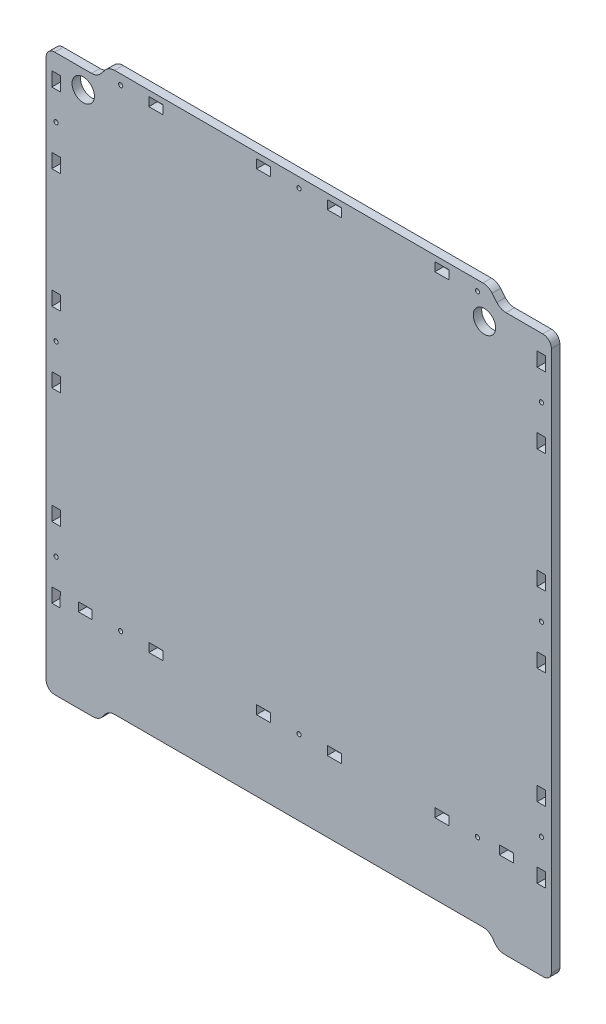
from build123d import *

# Parameters (mm, degrees)
SKETCH_1_R      = 1.5
SKETCH_1_R_2    = 7.9
SKETCH_1_W      = 6
SKETCH_1_H      = 10
SKETCH_1_W_2    = 9.974357274
SKETCH_1_H_2    = 6.199787221
SKETCH_1_W_3    = 9.96963529
SKETCH_1_W_4    = 9.994814167
SKETCH_1_H_3    = 6.199822499
SKETCH_1_W_5    = 9.849167249
SKETCH_1_W_6    = 9.971716679
SKETCH_1_H_4    = 6.19978722
SKETCH_1_W_7    = 9.849167498
SKETCH_1_W_8    = 9.976438662
SKETCH_1_W_9    = 9.949996323
SKETCH_1_W_10   = 9.973103267
EXTRUDE_1_DEPTH = 6


with BuildPart() as part:
    # Эскиз1 → Бобышка-Вытянуть1 (new body)
    with BuildSketch(Plane.XY):
        with BuildLine():
            Line((146.861398458, 191.532325026), (172.897783364, 191.532325026))
            ThreePointArc((172.897783364, 191.532325026), (177.136670981, 189.778724862), (178.897783364, 185.542952802))
            Line((178.897783364, 185.542952802), (178.897783364, -196.675834418))
            ThreePointArc((178.897783364, -196.675834418), (176.952338072, -200.464395383), (172.897783364, -201.767674974))
            Line((172.897783364, -201.767674974), (145.861398458, -201.767674974))
            ThreePointArc((145.861398458, -201.767674974), (142.269143233, -200.971291164), (139.350020692, -198.731369657))
            Line((139.350020692, -198.731369657), (137.054194639, -195.711716561))
            ThreePointArc((137.054194639, -195.711716561), (134.135072097, -193.471795054), (130.542816872, -192.675411244))
            Line((130.542816872, -192.675411244), (-129.747250144, -192.675411244))
            ThreePointArc((-129.747250144, -192.675411244), (-133.339505369, -193.471795054), (-136.258627911, -195.711716561))
            Line((-136.258627911, -195.711716561), (-138.554453964, -198.731369657))
            ThreePointArc((-138.554453964, -198.731369657), (-141.473576506, -200.971291164), (-145.06583173, -201.767674974))
            Line((-145.06583173, -201.767674974), (-172.102216636, -201.767674974))
            ThreePointArc((-172.102216636, -201.767674974), (-176.344857323, -200.010315661), (-178.102216636, -195.767674974))
            Line((-178.102216636, -195.767674974), (-178.102216636, 185.542952802))
            ThreePointArc((-178.102216636, 185.542952802), (-176.341104253, 189.778724862), (-172.102216636, 191.532325026))
            Line((-172.102216636, 191.532325026), (-146.06583173, 191.532325026))
            ThreePointArc((-146.06583173, 191.532325026), (-142.473576506, 192.328708836), (-139.554453964, 194.568630343))
            Line((-139.554453964, 194.568630343), (-136.258627911, 198.496442883))
            ThreePointArc((-136.258627911, 198.496442883), (-133.339449219, 200.73613298), (-129.747250144, 201.532325026))
            Line((-129.747250144, 201.532325026), (130.542816872, 201.532325026))
            ThreePointArc((130.542816872, 201.532325026), (134.135072097, 200.735941215), (137.054194639, 198.496019708))
            Line((137.054194639, 198.496019708), (140.350020692, 194.568207169))
            ThreePointArc((140.350020692, 194.568207169), (143.269199383, 192.328517071), (146.861398458, 191.532325026))
        make_face()
        with Locations((126.685666009, -139.542345576)):
            Circle(SKETCH_1_R, mode=Mode.SUBTRACT)
        with Locations((0.618552859, -139.542345576)):
            Circle(SKETCH_1_R, mode=Mode.SUBTRACT)
        with Locations((-125.506683527, -139.542345576)):
            Circle(SKETCH_1_R, mode=Mode.SUBTRACT)
        with Locations((-171.102216636, -116.737674974)):
            Circle(SKETCH_1_R, mode=Mode.SUBTRACT)
        with Locations((-171.102216636, 14.972325026)):
            Circle(SKETCH_1_R, mode=Mode.SUBTRACT)
        with Locations((171.897783364, 149.132325026)):
            Circle(SKETCH_1_R, mode=Mode.SUBTRACT)
        with Locations((126.704950995, 194.580646485)):
            Circle(SKETCH_1_R, mode=Mode.SUBTRACT)
        with Locations((-151.902216636, 178.532325026)):
            Circle(SKETCH_1_R_2, mode=Mode.SUBTRACT)
        with Locations((171.897783364, -116.737674974)):
            Circle(SKETCH_1_R, mode=Mode.SUBTRACT)
        with Locations((171.897783364, 14.972325026)):
            Circle(SKETCH_1_R, mode=Mode.SUBTRACT)
        with Locations((-171.102216636, 149.132325026)):
            Circle(SKETCH_1_R, mode=Mode.SUBTRACT)
        with Locations((-125.467806558, 194.580646485)):
            Circle(SKETCH_1_R, mode=Mode.SUBTRACT)
        with Locations((0.600947786, 194.580646485)):
            Circle(SKETCH_1_R, mode=Mode.SUBTRACT)
        with Locations((131.597783364, 178.532325026)):
            Circle(SKETCH_1_R_2, mode=Mode.SUBTRACT)
        with Locations((-171.102216636, 39.972325026)):
            Rectangle(SKETCH_1_W, SKETCH_1_H, mode=Mode.SUBTRACT)
        with Locations((171.897783364, 39.972325026)):
            Rectangle(SKETCH_1_W, SKETCH_1_H, mode=Mode.SUBTRACT)
        Polygon((174.897783364, 179.132325026), (174.897783364, 169.359038573), (174.897783364, 169.132325026), (168.897783364, 169.132325026), (168.897783364, 179.132325026), align=None, mode=Mode.SUBTRACT)
        Polygon((96.620692742, 197.626307922), (106.419868277, 197.643375977), (106.620692742, 197.626307922), (106.620692742, 191.426520702), (106.419868277, 191.443375977), (96.620692742, 191.426520702), align=None, mode=Mode.SUBTRACT)
        with Locations((25.533740214, -139.575517633)):
            Rectangle(SKETCH_1_W_2, SKETCH_1_H_2, mode=Mode.SUBTRACT)
        with Locations((-24.46393863, -139.575517633)):
            Rectangle(SKETCH_1_W_3, SKETCH_1_H_2, mode=Mode.SUBTRACT)
        with Locations((-171.102216636, 174.132325026)):
            Rectangle(SKETCH_1_W, SKETCH_1_H, mode=Mode.SUBTRACT)
        with Locations((101.618099825, -139.576911106)):
            Rectangle(SKETCH_1_W_4, SKETCH_1_H_3, mode=Mode.SUBTRACT)
        with Locations((147.077476572, -139.576911106)):
            Rectangle(SKETCH_1_W_5, SKETCH_1_H_3, mode=Mode.SUBTRACT)
        with Locations((-24.462897936, 194.528813201)):
            Rectangle(SKETCH_1_W_6, SKETCH_1_H_4, mode=Mode.SUBTRACT)
        with Locations((-171.102216636, 124.132325026)):
            Rectangle(SKETCH_1_W, SKETCH_1_H, mode=Mode.SUBTRACT)
        with Locations((-150.498155392, -139.576911106)):
            Rectangle(SKETCH_1_W_7, SKETCH_1_H_3, mode=Mode.SUBTRACT)
        with Locations((25.534780908, 194.528813201)):
            Rectangle(SKETCH_1_W_8, SKETCH_1_H_4, mode=Mode.SUBTRACT)
        with Locations((-171.102216636, -10.027674974)):
            Rectangle(SKETCH_1_W, SKETCH_1_H, mode=Mode.SUBTRACT)
        with Locations((-171.102216636, -91.757674974)):
            Rectangle(SKETCH_1_W, SKETCH_1_H, mode=Mode.SUBTRACT)
        Polygon((-174.102216636, -136.747674974), (-168.102216636, -136.747674974), (-168.289424992, -146.747674974), (-174.102216636, -146.747674974), align=None, mode=Mode.SUBTRACT)
        with Locations((-100.548530817, -139.576911106)):
            Rectangle(SKETCH_1_W_9, SKETCH_1_H_3, mode=Mode.SUBTRACT)
        with Locations((171.897783364, -10.027674974)):
            Rectangle(SKETCH_1_W, SKETCH_1_H, mode=Mode.SUBTRACT)
        with Locations((171.897783364, -91.757674974)):
            Rectangle(SKETCH_1_W, SKETCH_1_H, mode=Mode.SUBTRACT)
        with Locations((171.897783364, -141.747674974)):
            Rectangle(SKETCH_1_W, SKETCH_1_H, mode=Mode.SUBTRACT)
        with Locations((171.897783364, 124.132325026)):
            Rectangle(SKETCH_1_W, SKETCH_1_H, mode=Mode.SUBTRACT)
        with Locations((-100.536977345, 194.526414312)):
            Rectangle(SKETCH_1_W_10, SKETCH_1_H_4, mode=Mode.SUBTRACT)
    extrude(amount=EXTRUDE_1_DEPTH)


solid = part.part
